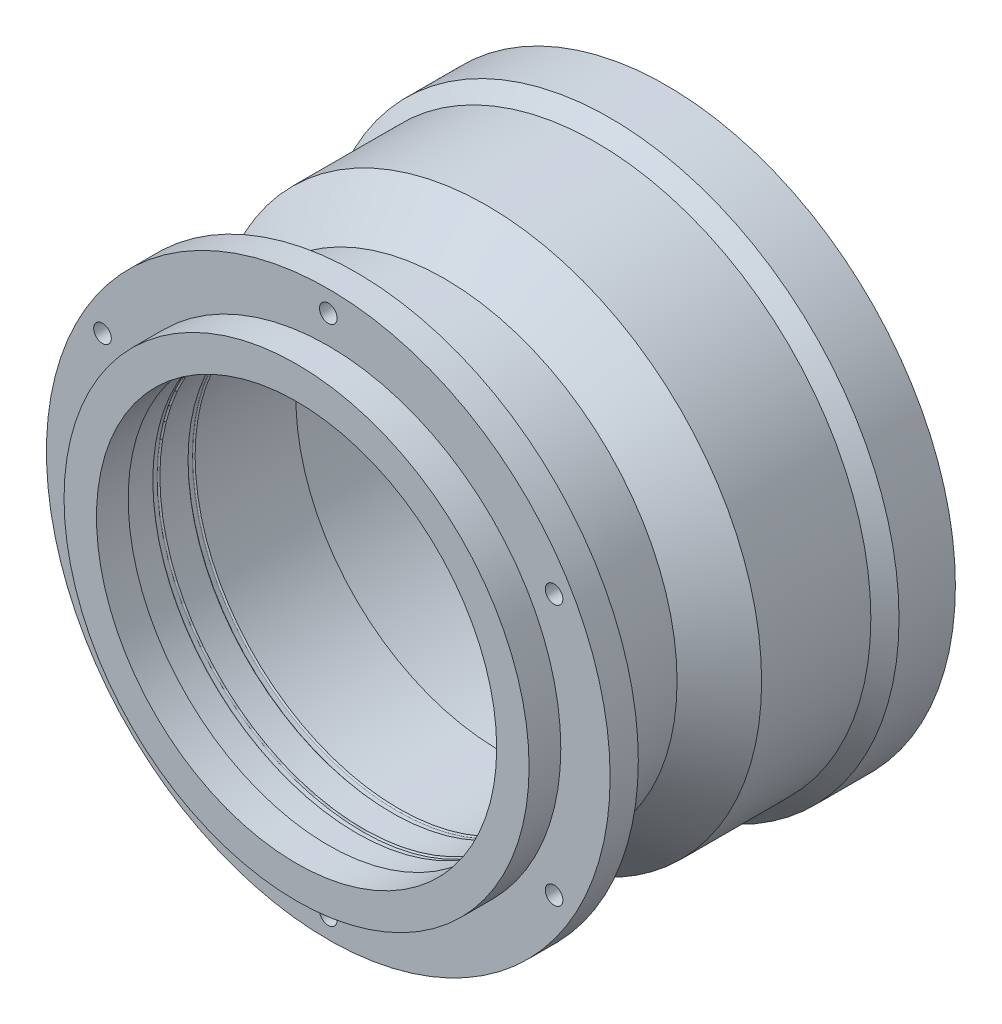
from build123d import *

# Parameters (mm, degrees)
OTHER_START              = -8.5
OTHER_2_OUTLINE_R        = 1.25
OTHER_2_DEPTH            = 4
PATTERN_CIRCULAR_1_COUNT = 6
PATTERN_CIRCULAR_2_COUNT = 3
PATTERN_CIRCULAR_3_COUNT = 12
CHAMFER_1_SIZE           = 1
CHAMFER_2_SIZE           = 2
CHAMFER_3_SIZE           = 0.5
CHAMFER_4_SIZE           = 6


# Read off the part's stored shape, not the designer's step: 高级异型孔2, 高级异型孔3, 高级异型孔4
with BuildPart() as part:
    # 草图2 → 旋转2 (revolve)
    with BuildSketch(Plane(origin=(0, 0, 0), x_dir=(0, 0, -1), z_dir=(1, 0, 0)), mode=Mode.PRIVATE) as revolve_2_sk:
        Polygon((0, 33), (0, 28.4), (4.5, 28.4), (4.5, 28.9), (28.8, 28.9), (28.8, 35), (52.5, 35), (52.5, 41), (42.5, 41), (42.5, 39), (21, 39), (21, 33), (8.5, 33), (8.5, 40), (4.5, 40), (4.5, 33), align=None)
    revolve(revolve_2_sk.sketch.rotate(Axis((0, 0, 0), (0, 0, -1)), 90), axis=Axis((0, 0, 0), (0, 0, -1)))

    # 高级异型孔2 outline → 高级异型孔2 (cut)
    with BuildSketch(Plane.XY.offset(OTHER_START)):
        with Locations((0, 37)):
            Circle(OTHER_2_OUTLINE_R)
    other_2 = extrude(amount=OTHER_2_DEPTH, mode=Mode.SUBTRACT)

    # 高级异型孔3 outline → 高级异型孔3 (revolve, cut)
    with BuildSketch(Plane.XZ.offset(-31.5)):
        Polygon((1.25, -28.8), (1.25, -23.8), (0, -23.048924226), (0, -28.8), align=None)
    other_3 = revolve(axis=Axis((0, 31.5, 0), (0, 0, 1)), mode=Mode.SUBTRACT)

    # 高级异型孔4 outline → 高级异型孔4 (revolve, cut)
    with BuildSketch(Plane.XZ.offset(-38)):
        Polygon((1.25, -52.5), (1.25, -46.5), (0, -45.748924226), (0, -52.5), align=None)
    other_4 = revolve(axis=Axis((0, 38, 0), (0, 0, 1)), mode=Mode.SUBTRACT)

    # 阵列(圆周)1: 高级异型孔2 ×6 about axis
    pattern_circular_1_axis = Axis((0, 0, 0), (0, 0, 1))
    for i in range(1, PATTERN_CIRCULAR_1_COUNT):
        add(other_2.rotate(pattern_circular_1_axis, i * 360 / PATTERN_CIRCULAR_1_COUNT), mode=Mode.SUBTRACT)

    # 阵列(圆周)2: 高级异型孔3 ×3 about axis
    pattern_circular_2_axis = Axis((0, 0, 0), (0, 0, 1))
    for i in range(1, PATTERN_CIRCULAR_2_COUNT):
        add(other_3.rotate(pattern_circular_2_axis, i * 360 / PATTERN_CIRCULAR_2_COUNT), mode=Mode.SUBTRACT)

    # 阵列(圆周)3: 高级异型孔4 ×12 about axis
    pattern_circular_3_axis = Axis((0, 0, 0), (0, 0, 1))
    for i in range(1, PATTERN_CIRCULAR_3_COUNT):
        add(other_4.rotate(pattern_circular_3_axis, i * 360 / PATTERN_CIRCULAR_3_COUNT), mode=Mode.SUBTRACT)

    # 倒角1
    chamfer_1_edges = [part.edges().sort_by_distance(p)[0] for p in [
        (-33, 0, -8.5),
    ]]
    chamfer(chamfer_1_edges, length=CHAMFER_1_SIZE)

    # 倒角2
    chamfer_2_edges = [part.edges().sort_by_distance(p)[0] for p in [
        (-41, 0, -42.5),
    ]]
    chamfer(chamfer_2_edges, length=CHAMFER_2_SIZE - 0.0001)  # a hair under: the kernel refuses the full size

    # 倒角3
    chamfer_3_edges = [part.edges().sort_by_distance(p)[0] for p in [
        (-35, 0, -52.5),
    ]]
    chamfer(chamfer_3_edges, length=CHAMFER_3_SIZE)

    # 倒角4
    chamfer_4_edges = [part.edges().sort_by_distance(p)[0] for p in [
        (-39, 0, -21),
    ]]
    chamfer(chamfer_4_edges, length=CHAMFER_4_SIZE - 0.0001)  # a hair under: the kernel refuses the full size

    # 草图16 → 切除-旋转1 (revolve, cut)
    with BuildSketch(Plane(origin=(0, 0, 0), x_dir=(0, 0, -1), z_dir=(1, 0, 0)), mode=Mode.PRIVATE) as cut_revolve_1_sk:
        with BuildLine():
            Line((13.7, 29.1), (14.3, 29.1))
            ThreePointArc((14.3, 29.1), (14.441421356, 29.041421356), (14.5, 28.9))
            Line((14.5, 28.9), (14.5, 28.7))
            Line((14.5, 28.7), (13.5, 28.7))
            Line((13.5, 28.7), (13.5, 28.9))
            ThreePointArc((13.5, 28.9), (13.558578644, 29.041421356), (13.7, 29.1))
        make_face()
        with BuildLine():
            Line((8.5, 28.7), (9.5, 28.7))
            Line((9.5, 28.7), (9.5, 28.9))
            ThreePointArc((9.5, 28.9), (9.441421356, 29.041421356), (9.3, 29.1))
            Line((9.3, 29.1), (8.7, 29.1))
            ThreePointArc((8.7, 29.1), (8.558578644, 29.041421356), (8.5, 28.9))
            Line((8.5, 28.9), (8.5, 28.7))
        make_face()
    revolve(cut_revolve_1_sk.sketch.rotate(Axis((0, 0, -4.5), (0, 0, 1)), 90), axis=Axis((0, 0, -4.5), (0, 0, 1)), mode=Mode.SUBTRACT)


solid = part.part
